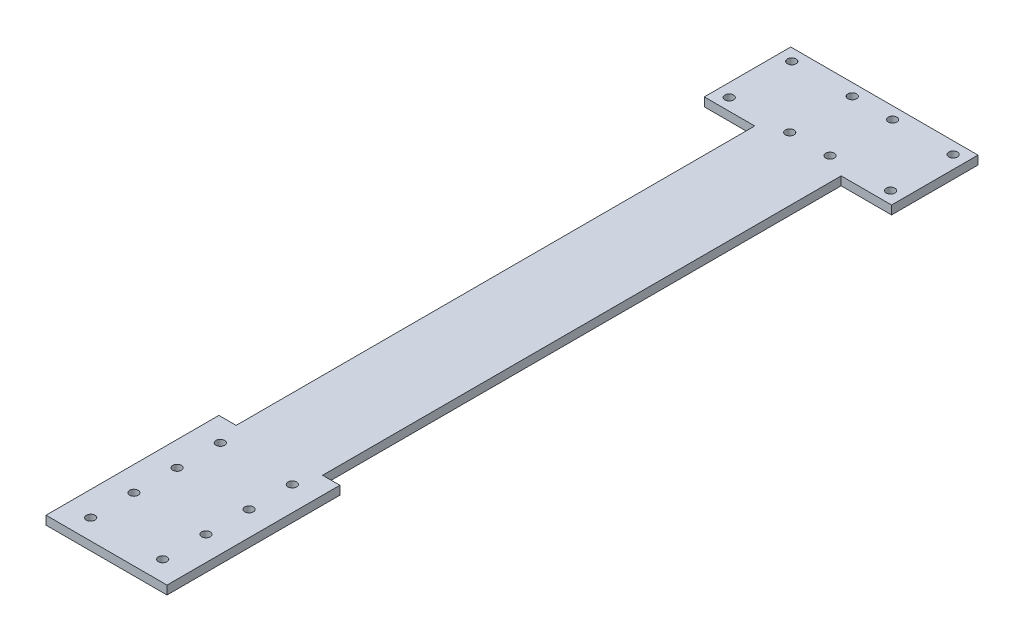
from build123d import *

# Parameters (mm, degrees)
BOSS_EXTRUDE1_DEPTH = 3
SKETCH2_R           = 1.5
CUT_EXTRUDE1_DEPTH  = 272.965530904
SKETCH3_R           = 1.5
CUT_EXTRUDE2_DEPTH  = 272.965530904
LPATTERN1_COUNT     = 4
LPATTERN1_PITCH     = 15


with BuildPart() as part:
    # Sketch1 → Boss-Extrude1 (new body)
    with BuildSketch(Plane(origin=(0, 0, 0), x_dir=(1, 0, 0), z_dir=(0, 1, 0))):
        Polygon((32.5, 270), (-32.5, 270), (-32.5, 240), (-15, 240), (-15, 60), (-21, 60), (-21, 0), (21, 0), (21, 60), (15, 60), (15, 240), (32.5, 240), align=None)
    extrude(amount=BOSS_EXTRUDE1_DEPTH)

    # Sketch2 → Cut-Extrude1 (cut, symmetric)
    with BuildSketch(Plane(origin=(0, 3, 0), x_dir=(1, 0, 0), z_dir=(0, 1, 0))):
        with Locations((-28, 265.85)):
            Circle(SKETCH2_R)
        with Locations((-7, 265.85)):
            Circle(SKETCH2_R)
        with Locations((-28, 244.15)):
            Circle(SKETCH2_R)
        with Locations((-7, 244.15)):
            Circle(SKETCH2_R)
    cut_extrude1 = extrude(amount=CUT_EXTRUDE1_DEPTH, both=True, mode=Mode.SUBTRACT)

    # Mirror1: Cut-Extrude1 across plane
    add(cut_extrude1.mirror(Plane(origin=(0, 0, 0), x_dir=(0, 0, 1), z_dir=(1, 0, 0))), mode=Mode.SUBTRACT)

    # Sketch3 → Cut-Extrude2 (cut, symmetric)
    with BuildSketch(Plane(origin=(0, 3, 0), x_dir=(1, 0, 0), z_dir=(0, 1, 0))):
        with Locations((-12.5, 52)):
            Circle(SKETCH3_R)
        with Locations((12.5, 52)):
            Circle(SKETCH3_R)
    cut_extrude2 = extrude(amount=CUT_EXTRUDE2_DEPTH, both=True, mode=Mode.SUBTRACT)

    # LPattern1: Cut-Extrude2 ×4
    with Locations(*[(0, 0, i * LPATTERN1_PITCH) for i in range(1, LPATTERN1_COUNT)]):
        add(cut_extrude2, mode=Mode.SUBTRACT)


solid = part.part
